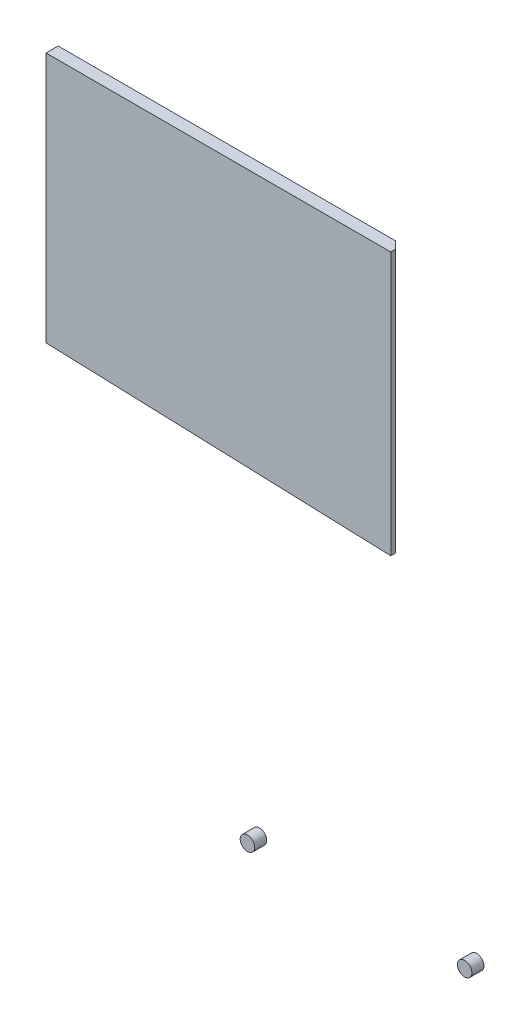
from build123d import *

# Parameters (mm, degrees)
SKETCH_2_R        = 3
EXTRUDE_2_DEPTH   = 5
EXTRUDE_2_2_DEPTH = 5
EXTRUDE_2_3_DEPTH = 5
CHAMFER_1_SIZE    = 3


with BuildPart() as part:
    # Эскиз2 → Бобышка-Вытянуть2 (new body)
    with BuildSketch(Plane(origin=(0, 0, 206.9894311), x_dir=(-1, 0, 0), z_dir=(0, 0, -1))):
        with Locations((32.234862461, -141.965937893)):
            Circle(SKETCH_2_R)
    extrude(amount=EXTRUDE_2_DEPTH)


with BuildPart() as body_2:
    # Эскиз2 → Extrude 2 2 (new body)
    with BuildSketch(Plane(origin=(0, 0, 206.9894311), x_dir=(-1, 0, 0), z_dir=(0, 0, -1))):
        with Locations((-57.765137539, -141.965937893)):
            Circle(SKETCH_2_R)
    extrude(amount=EXTRUDE_2_2_DEPTH)


with BuildPart() as body_3:
    # Эскиз2 → Extrude 2 3 (new body)
    with BuildSketch(Plane(origin=(0, 0, 206.9894311), x_dir=(-1, 0, 0), z_dir=(0, 0, -1))):
        Polygon((-27.147885215, 99.858683519), (115.676736197, 99.858683519), (115.676736197, -4.138468105), (-27.147885215, -9.141316481), align=None)
    extrude(amount=EXTRUDE_2_3_DEPTH)

    # Фаска1
    chamfer_1_edges = [body_3.edges().sort_by_distance(p)[0] for p in [
        (27.147885215, 45.358683519, 201.9894311),
    ]]
    chamfer(chamfer_1_edges, length=CHAMFER_1_SIZE)


solid = Compound([part.part, body_2.part, body_3.part])
